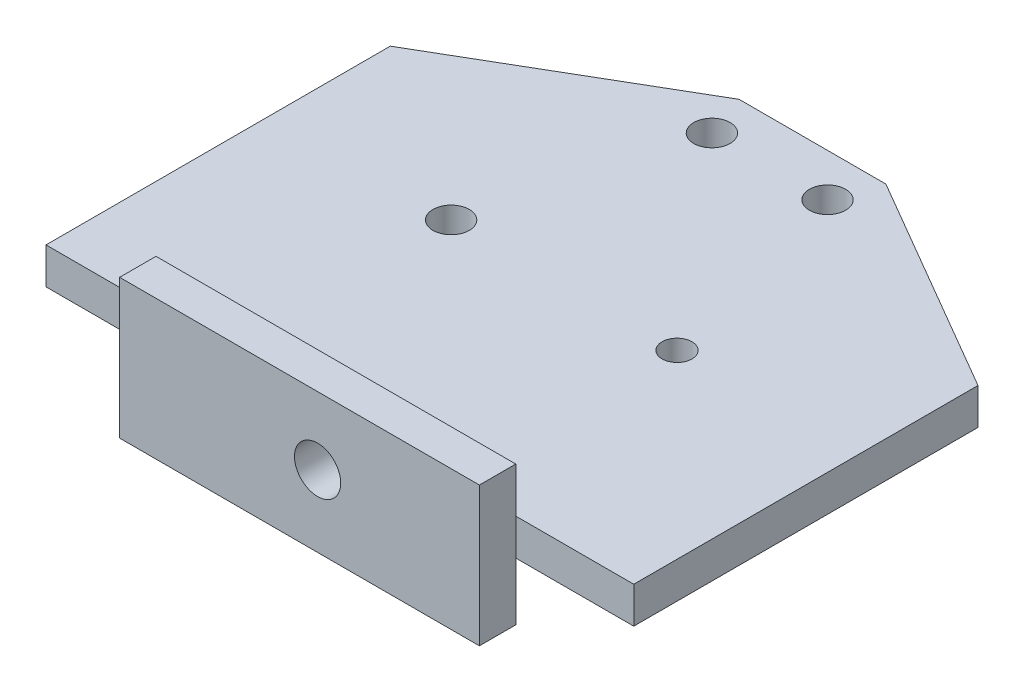
from build123d import *

# Parameters (mm, degrees)
CROQUIS1_R              = 1.5
CROQUIS1_R_2            = 1.231641092
SALIENTE_EXTRUIR1_DEPTH = 3
CROQUIS2_W              = 29.687017891
CROQUIS2_H              = 11.494301456
SALIENTE_EXTRUIR2_DEPTH = 3
CROQUIS3_R              = 1.909031405
CORTAR_EXTRUIR1_DEPTH   = 3


with BuildPart() as part:
    # Croquis1 → Saliente-Extruir1 (new body)
    with BuildSketch(Plane(origin=(0, 0, 0), x_dir=(1, 0, 0), z_dir=(0, 1, 0))):
        Polygon((-6.055811774, 19.5), (-24.25, 8.906478004), (-24.25, -19.5), (24.25, -19.5), (24.25, 8.906478004), (6.055811774, 19.5), align=None)
        with Locations((-4.77, 15.97)):
            Circle(CROQUIS1_R, mode=Mode.SUBTRACT)
        with Locations((4.77, 15.97)):
            Circle(CROQUIS1_R, mode=Mode.SUBTRACT)
        with Locations((-9.32, -1)):
            Circle(CROQUIS1_R, mode=Mode.SUBTRACT)
        with Locations((9.32, -1)):
            Circle(CROQUIS1_R_2, mode=Mode.SUBTRACT)
    extrude(amount=SALIENTE_EXTRUIR1_DEPTH)

    # Croquis2 → Saliente-Extruir2 (add)
    with BuildSketch(Plane.XY.offset(19.5)):
        with Locations((-0.330418917, 0.97409671)):
            Rectangle(CROQUIS2_W, CROQUIS2_H)
    extrude(amount=SALIENTE_EXTRUIR2_DEPTH)

    # Croquis3 → Cortar-Extruir1 (cut)
    with BuildSketch(Plane.XY.offset(22.5)):
        with Locations((1.162538812, 1.134521214)):
            Circle(CROQUIS3_R)
    extrude(amount=-CORTAR_EXTRUIR1_DEPTH, mode=Mode.SUBTRACT)


solid = part.part
